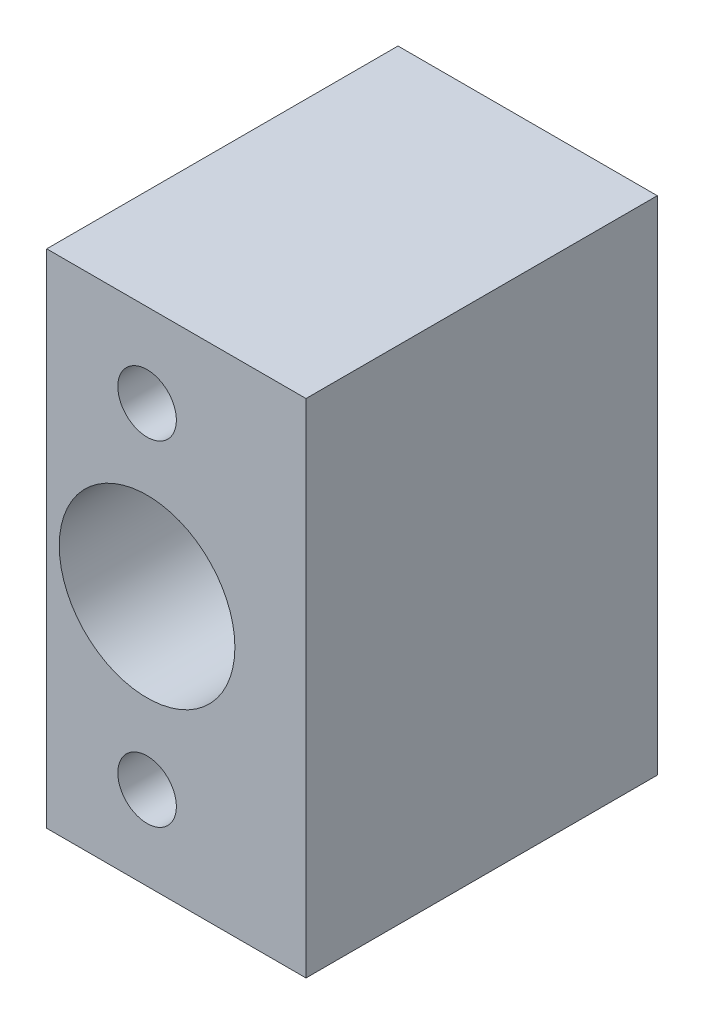
from build123d import *

# Parameters (mm, degrees)
SKETCH1_W               = 19
SKETCH1_H               = 30
BOSS_EXTRUDE1_DEPTH     = 18
SKETCH2_R               = 5.25
CUT_EXTRUDE1_DEPTH      = 11.5
SKETCH4_R               = 4.8
CUT_EXTRUDE3_DEPTH      = 1
CUT_EXTRUDE4_DEPTH      = 22.714050751
CUT_EXTRUDE4_DEPTH_BACK = 5
SKETCH5_R               = 2.36
CUT_EXTRUDE6_DEPTH      = 26.28339376
CUT_EXTRUDE6_DEPTH_BACK = 26.28339376
SKETCH11_W              = 15.5
SKETCH11_H              = 30
BOSS_EXTRUDE5_DEPTH     = 5
SKETCH12_R              = 4
CUT_EXTRUDE8_DEPTH      = 5
SKETCH13_R              = 1.75
CUT_EXTRUDE9_DEPTH      = 30.055980452
SKETCH14_R              = 3
CUT_EXTRUDE10_DEPTH     = 1
SKETCH15_W              = 15.5
SKETCH15_H              = 2
CUT_EXTRUDE11_DEPTH     = 41
SKETCH17_R              = 5
CUT_EXTRUDE12_DEPTH     = 2
SKETCH20_R              = 3.81
CUT_EXTRUDE13_DEPTH     = 9


with BuildPart() as part:
    # Sketch1 → Boss-Extrude1 (new body)
    with BuildSketch(Plane.XY):
        Rectangle(SKETCH1_W, SKETCH1_H)
    extrude(amount=BOSS_EXTRUDE1_DEPTH)

    # Sketch2 → Cut-Extrude1 (cut)
    with BuildSketch(Plane.XY.offset(18)):
        Circle(SKETCH2_R)
    extrude(amount=-CUT_EXTRUDE1_DEPTH, mode=Mode.SUBTRACT)

    # Sketch4 → Cut-Extrude3 (cut)
    with BuildSketch(Plane.XY.offset(6.5)):
        Circle(SKETCH4_R)
    extrude(amount=-CUT_EXTRUDE3_DEPTH, mode=Mode.SUBTRACT)

    # Sketch5 → Cut-Extrude4 (cut, two sides: drawn at the far end of the back side and taken through both)
    with BuildSketch(Plane.XY.offset(5.5).offset(-CUT_EXTRUDE4_DEPTH_BACK)):
        Circle(SKETCH5_R)
    extrude(amount=CUT_EXTRUDE4_DEPTH + CUT_EXTRUDE4_DEPTH_BACK, mode=Mode.SUBTRACT)

    # Sketch6 → Cut-Extrude6 (cut, two sides: drawn at the far end of the back side and taken through both)
    with BuildSketch(Plane.XY.offset(-CUT_EXTRUDE6_DEPTH_BACK)):
        Polygon((-6, 92.53517602), (-6, 15), (-6, -15), (-6, -92.53517602), (-161.070352039, -92.53517602), (-161.070352039, 92.53517602), align=None)
    extrude(amount=CUT_EXTRUDE6_DEPTH + CUT_EXTRUDE6_DEPTH_BACK, mode=Mode.SUBTRACT)

    # Sketch11 → Boss-Extrude5 (add)
    with BuildSketch(Plane(origin=(0, 0, 0), x_dir=(-1, 0, 0), z_dir=(0, 0, -1))):
        with Locations((-1.75, 0)):
            Rectangle(SKETCH11_W, SKETCH11_H)
    extrude(amount=BOSS_EXTRUDE5_DEPTH)

    # Sketch12 → Cut-Extrude8 (cut)
    with BuildSketch(Plane(origin=(0, 0, -5), x_dir=(-1, 0, 0), z_dir=(0, 0, -1))):
        Circle(SKETCH12_R)
    extrude(amount=-CUT_EXTRUDE8_DEPTH, mode=Mode.SUBTRACT)

    # Sketch13 → Cut-Extrude9 (cut, through all)
    with BuildSketch(Plane(origin=(0, 0, -5), x_dir=(-1, 0, 0), z_dir=(0, 0, -1))):
        with Locations((0, -10)):
            Circle(SKETCH13_R)
        with Locations((0, 10)):
            Circle(SKETCH13_R)
    extrude(amount=-CUT_EXTRUDE9_DEPTH, mode=Mode.SUBTRACT)

    # Sketch14 → Cut-Extrude10 (cut)
    with BuildSketch(Plane.XY.offset(5.5)):
        Circle(SKETCH14_R)
    extrude(amount=-CUT_EXTRUDE10_DEPTH, mode=Mode.SUBTRACT)

    # Sketch15 → Cut-Extrude11 (cut)
    with BuildSketch(Plane.XZ.offset(15)):
        with Locations((1.75, 17)):
            Rectangle(SKETCH15_W, SKETCH15_H)
    extrude(amount=-CUT_EXTRUDE11_DEPTH, mode=Mode.SUBTRACT)

    # Sketch17 → Cut-Extrude12 (cut)
    with BuildSketch(Plane(origin=(-6, -15, -5), x_dir=(0.9209034917442324, -0.31932895127596433, -0.22353026589317507), z_dir=(0.38979066034639764, 0.7544335361543176, 0.5281034753080227))):
        Circle(SKETCH17_R)
    extrude(amount=CUT_EXTRUDE12_DEPTH, mode=Mode.SUBTRACT)

    # Sketch20 → Cut-Extrude13 (cut)
    with BuildSketch(Plane(origin=(0, 0, -5), x_dir=(-1, 0, 0), z_dir=(0, 0, -1))):
        with Locations((0, 10)):
            Circle(SKETCH20_R)
        with Locations((0, -10)):
            Circle(SKETCH20_R)
    extrude(amount=-CUT_EXTRUDE13_DEPTH, mode=Mode.SUBTRACT)


solid = part.part
